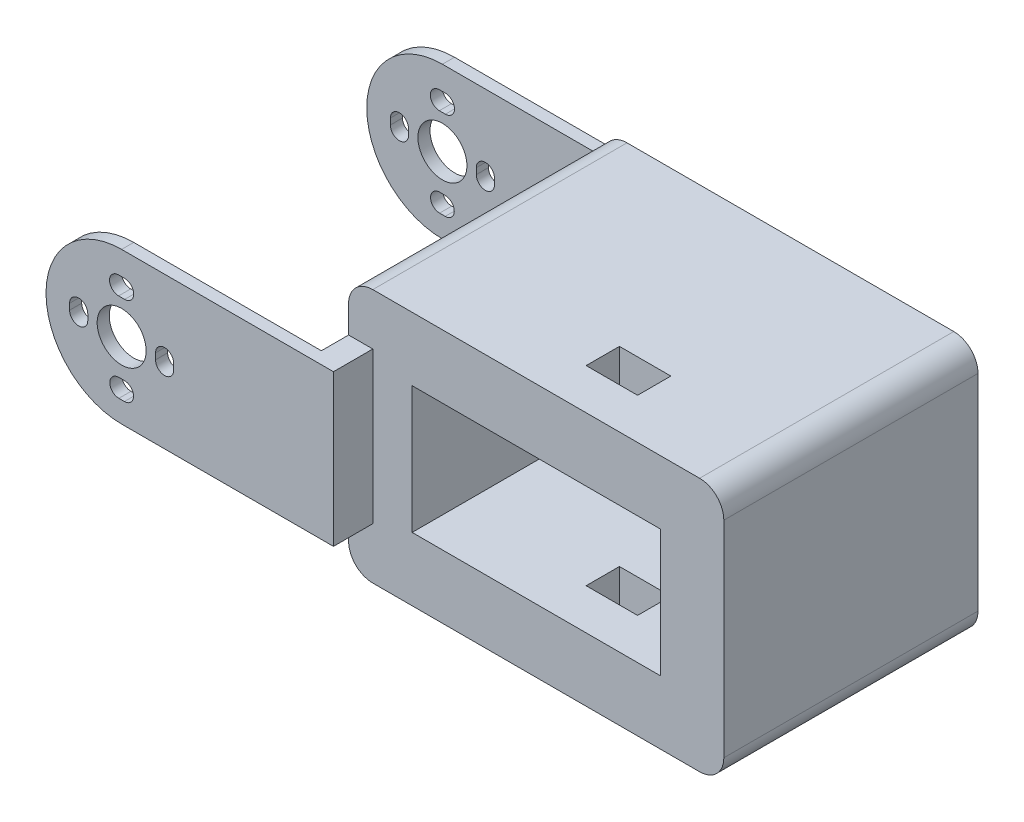
from build123d import *

# Parameters (mm, degrees)
SKETCH1_W           = 62
SKETCH1_H           = 42
SKETCH1_W_2         = 41
SKETCH1_H_2         = 21
BOSS_EXTRUDE1_DEPTH = 42
SKETCH2_W           = 4
SKETCH2_H           = 25
BOSS_EXTRUDE2_DEPTH = 4.5
SKETCH2_2_W         = 4
SKETCH2_2_H         = 25
BOSS_EXTRUDE3_DEPTH = 45.55
SKETCH3_R           = 4.05
BOSS_EXTRUDE6_DEPTH = 2
BOSS_EXTRUDE7_START = -53
SKETCH3_8_R         = 4.05
BOSS_EXTRUDE7_DEPTH = 53
CUT_EXTRUDE1_START  = -51
SKETCH3_11_R        = 4.05
CUT_EXTRUDE1_DEPTH  = 51
SKETCH_1_W          = 8.5
SKETCH_1_H          = 5.5
CUT_EXTRUDE_1_DEPTH = 42
FILLET_3_R          = 4
FILLET_4_R          = 4
FILLET_5_R          = 4
FILLET_6_R          = 4


with BuildPart() as part:
    # Sketch1 → Boss-Extrude1 (new body)
    with BuildSketch(Plane.XY):
        with Locations((1.904162196, -4.136072895)):
            Rectangle(SKETCH1_W, SKETCH1_H)
        with Locations((1.904162196, -4.136072895)):
            Rectangle(SKETCH1_W_2, SKETCH1_H_2, mode=Mode.SUBTRACT)
    extrude(amount=BOSS_EXTRUDE1_DEPTH)

    # Sketch2 → Boss-Extrude2 (add)
    with BuildSketch(Plane.XY.offset(42)):
        with Locations((-27.095837804, -4.136072895)):
            Rectangle(SKETCH2_W, SKETCH2_H)
    extrude(amount=BOSS_EXTRUDE2_DEPTH)

    # Sketch2<2> → Boss-Extrude3 (add)
    with BuildSketch(Plane.XY.offset(42)):
        with Locations((-27.095837804, -4.136072895)):
            Rectangle(SKETCH2_2_W, SKETCH2_2_H)
    extrude(amount=-BOSS_EXTRUDE3_DEPTH)

    # Sketch3 → Boss-Extrude6 (add)
    with BuildSketch(Plane.XY.offset(46.5)):
        with BuildLine():
            Line((-25.095837804, -16.636072895), (-25.095837804, 8.363927105))
            Line((-25.095837804, 8.363927105), (-60.095837804, 8.363927105))
            ThreePointArc((-60.095837804, 8.363927105), (-72.595837804, -4.136072895), (-60.095837804, -16.636072895))
            Line((-60.095837804, -16.636072895), (-25.095837804, -16.636072895))
        make_face()
        with BuildLine():
            Line((-51.495837804, -3.636072895), (-51.495837804, -4.636072895))
            ThreePointArc((-51.495837804, -4.636072895), (-52.995837804, -6.136072895), (-54.495837804, -4.636072895))
            Line((-54.495837804, -4.636072895), (-54.495837804, -3.636072895))
            ThreePointArc((-54.495837804, -3.636072895), (-52.995837804, -2.136072895), (-51.495837804, -3.636072895))
        make_face(mode=Mode.SUBTRACT)
        with BuildLine():
            Line((-59.635749439, -13.176248856), (-60.555926168, -13.176248856))
            ThreePointArc((-60.555926168, -13.176248856), (-62.055926168, -11.676248856), (-60.555926168, -10.176248856))
            Line((-60.555926168, -10.176248856), (-59.635749439, -10.176248856))
            ThreePointArc((-59.635749439, -10.176248856), (-58.135749439, -11.676248856), (-59.635749439, -13.176248856))
        make_face(mode=Mode.SUBTRACT)
        with Locations((-60.095837804, -4.136072895)):
            Circle(SKETCH3_R, mode=Mode.SUBTRACT)
        with BuildLine():
            Line((-59.595837804, 1.463927105), (-60.595837804, 1.463927105))
            ThreePointArc((-60.595837804, 1.463927105), (-62.095837804, 2.963927105), (-60.595837804, 4.463927105))
            Line((-60.595837804, 4.463927105), (-59.595837804, 4.463927105))
            ThreePointArc((-59.595837804, 4.463927105), (-58.095837804, 2.963927105), (-59.595837804, 1.463927105))
        make_face(mode=Mode.SUBTRACT)
        with BuildLine():
            ThreePointArc((-68.695837804, -3.636072895), (-67.195837804, -2.136072895), (-65.695837804, -3.636072895))
            Line((-65.695837804, -3.636072895), (-65.695837804, -4.636072895))
            ThreePointArc((-65.695837804, -4.636072895), (-67.195837804, -6.136072895), (-68.695837804, -4.636072895))
            Line((-68.695837804, -4.636072895), (-68.695837804, -3.636072895))
        make_face(mode=Mode.SUBTRACT)
    extrude(amount=BOSS_EXTRUDE6_DEPTH)

    # Sketch3<8> → Boss-Extrude7 (add)
    with BuildSketch(Plane.XY.offset(46.5).offset(BOSS_EXTRUDE7_START)):
        with BuildLine():
            Line((-25.095837804, -16.636072895), (-25.095837804, 8.363927105))
            Line((-25.095837804, 8.363927105), (-60.095837804, 8.363927105))
            ThreePointArc((-60.095837804, 8.363927105), (-72.595837804, -4.136072895), (-60.095837804, -16.636072895))
            Line((-60.095837804, -16.636072895), (-25.095837804, -16.636072895))
        make_face()
        with BuildLine():
            Line((-51.495837804, -3.636072895), (-51.495837804, -4.636072895))
            ThreePointArc((-51.495837804, -4.636072895), (-52.995837804, -6.136072895), (-54.495837804, -4.636072895))
            Line((-54.495837804, -4.636072895), (-54.495837804, -3.636072895))
            ThreePointArc((-54.495837804, -3.636072895), (-52.995837804, -2.136072895), (-51.495837804, -3.636072895))
        make_face(mode=Mode.SUBTRACT)
        with BuildLine():
            Line((-59.635749439, -13.176248856), (-60.555926168, -13.176248856))
            ThreePointArc((-60.555926168, -13.176248856), (-62.055926168, -11.676248856), (-60.555926168, -10.176248856))
            Line((-60.555926168, -10.176248856), (-59.635749439, -10.176248856))
            ThreePointArc((-59.635749439, -10.176248856), (-58.135749439, -11.676248856), (-59.635749439, -13.176248856))
        make_face(mode=Mode.SUBTRACT)
        with Locations((-60.095837804, -4.136072895)):
            Circle(SKETCH3_8_R, mode=Mode.SUBTRACT)
        with BuildLine():
            Line((-59.595837804, 1.463927105), (-60.595837804, 1.463927105))
            ThreePointArc((-60.595837804, 1.463927105), (-62.095837804, 2.963927105), (-60.595837804, 4.463927105))
            Line((-60.595837804, 4.463927105), (-59.595837804, 4.463927105))
            ThreePointArc((-59.595837804, 4.463927105), (-58.095837804, 2.963927105), (-59.595837804, 1.463927105))
        make_face(mode=Mode.SUBTRACT)
        with BuildLine():
            ThreePointArc((-68.695837804, -3.636072895), (-67.195837804, -2.136072895), (-65.695837804, -3.636072895))
            Line((-65.695837804, -3.636072895), (-65.695837804, -4.636072895))
            ThreePointArc((-65.695837804, -4.636072895), (-67.195837804, -6.136072895), (-68.695837804, -4.636072895))
            Line((-68.695837804, -4.636072895), (-68.695837804, -3.636072895))
        make_face(mode=Mode.SUBTRACT)
    extrude(amount=BOSS_EXTRUDE7_DEPTH)

    # Sketch3<11> → Cut-Extrude1 (cut)
    with BuildSketch(Plane.XY.offset(46.5).offset(CUT_EXTRUDE1_START)):
        with BuildLine():
            Line((-29.095837804, -16.636072895), (-29.095837804, 8.363927105))
            Line((-29.095837804, 8.363927105), (-60.095837804, 8.363927105))
            ThreePointArc((-60.095837804, 8.363927105), (-72.595837804, -4.136072895), (-60.095837804, -16.636072895))
            Line((-60.095837804, -16.636072895), (-29.095837804, -16.636072895))
        make_face()
        with BuildLine():
            Line((-59.635749439, -13.176248856), (-60.555926168, -13.176248856))
            ThreePointArc((-60.555926168, -13.176248856), (-62.055926168, -11.676248856), (-60.555926168, -10.176248856))
            Line((-60.555926168, -10.176248856), (-59.635749439, -10.176248856))
            ThreePointArc((-59.635749439, -10.176248856), (-58.135749439, -11.676248856), (-59.635749439, -13.176248856))
        make_face(mode=Mode.SUBTRACT)
        with Locations((-60.095837804, -4.136072895)):
            Circle(SKETCH3_11_R, mode=Mode.SUBTRACT)
        with BuildLine():
            Line((-59.595837804, 1.463927105), (-60.595837804, 1.463927105))
            ThreePointArc((-60.595837804, 1.463927105), (-62.095837804, 2.963927105), (-60.595837804, 4.463927105))
            Line((-60.595837804, 4.463927105), (-59.595837804, 4.463927105))
            ThreePointArc((-59.595837804, 4.463927105), (-58.095837804, 2.963927105), (-59.595837804, 1.463927105))
        make_face(mode=Mode.SUBTRACT)
        with BuildLine():
            ThreePointArc((-54.495837804, -3.636072895), (-52.995837804, -2.136072895), (-51.495837804, -3.636072895))
            Line((-51.495837804, -3.636072895), (-51.495837804, -4.636072895))
            ThreePointArc((-51.495837804, -4.636072895), (-52.995837804, -6.136072895), (-54.495837804, -4.636072895))
            Line((-54.495837804, -4.636072895), (-54.495837804, -3.636072895))
        make_face(mode=Mode.SUBTRACT)
        with BuildLine():
            ThreePointArc((-68.695837804, -3.636072895), (-67.195837804, -2.136072895), (-65.695837804, -3.636072895))
            Line((-65.695837804, -3.636072895), (-65.695837804, -4.636072895))
            ThreePointArc((-65.695837804, -4.636072895), (-67.195837804, -6.136072895), (-68.695837804, -4.636072895))
            Line((-68.695837804, -4.636072895), (-68.695837804, -3.636072895))
        make_face(mode=Mode.SUBTRACT)
    extrude(amount=CUT_EXTRUDE1_DEPTH, mode=Mode.SUBTRACT)

    # 草圖1 → 除料-伸長1 (cut)
    with BuildSketch(Plane(origin=(0, 16.863927105, 0), x_dir=(1, 0, 0), z_dir=(0, 1, 0))):
        with Locations((7.654162196, -32.5)):
            Rectangle(SKETCH_1_W, SKETCH_1_H)
    extrude(amount=-CUT_EXTRUDE_1_DEPTH, mode=Mode.SUBTRACT)

    # 圓角3
    fillet_3_edges = [part.edges().sort_by_distance(p)[0] for p in [
        (-29.095837804, 16.863927105, 21),
    ]]
    fillet(fillet_3_edges, radius=FILLET_3_R)

    # 圓角4
    fillet_4_edges = [part.edges().sort_by_distance(p)[0] for p in [
        (32.904162196, 16.863927105, 21),
    ]]
    fillet(fillet_4_edges, radius=FILLET_4_R)

    # 圓角5
    fillet_5_edges = [part.edges().sort_by_distance(p)[0] for p in [
        (32.904162196, -25.136072895, 21),
    ]]
    fillet(fillet_5_edges, radius=FILLET_5_R)

    # 圓角6
    fillet_6_edges = [part.edges().sort_by_distance(p)[0] for p in [
        (-29.095837804, -25.136072895, 21),
    ]]
    fillet(fillet_6_edges, radius=FILLET_6_R)


solid = part.part
